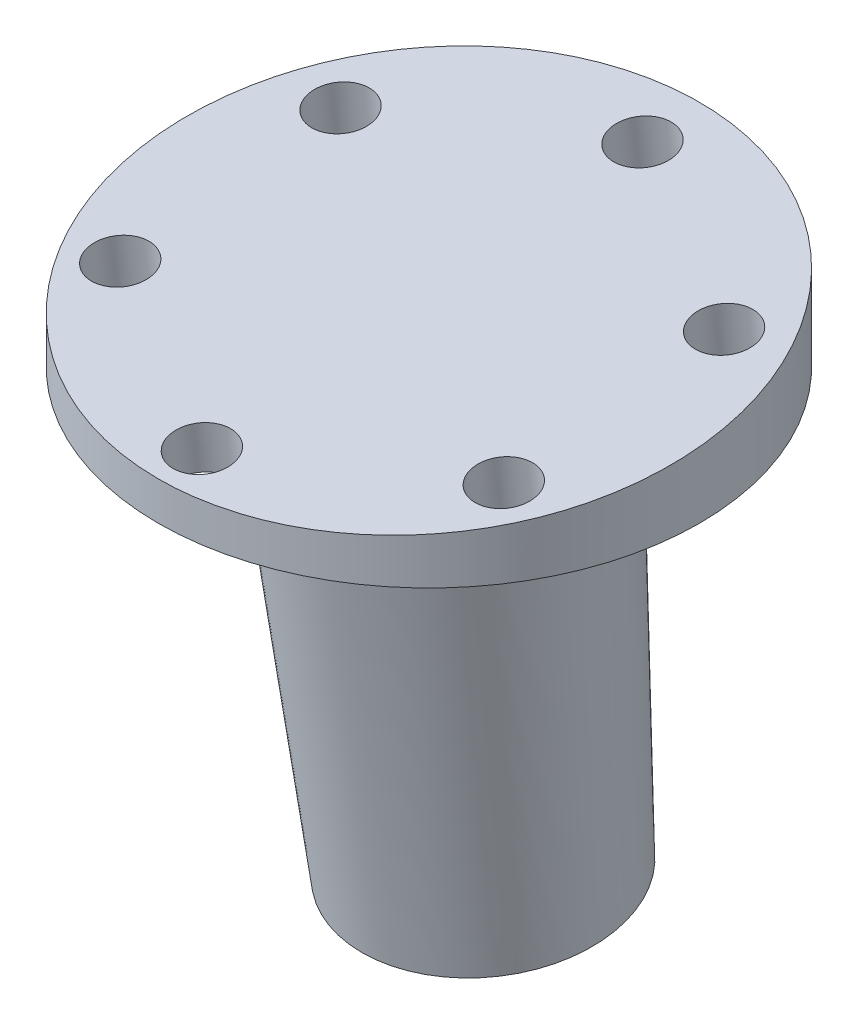
from build123d import *

# Parameters (mm, degrees)
SKETCH1_R           = 31.65
BOSS_EXTRUDE1_DEPTH = 11
CUT_EXTRUDE1_DEPTH  = 35.5
SKETCH3_R           = 3.375
CUT_EXTRUDE2_DEPTH  = 21
SKETCH4_R           = 14.25
BOSS_EXTRUDE2_DEPTH = 62
SHELL1_T            = -4.2


# Read off the part's stored shape, not the designer's step: Draft1, Split1
with BuildPart() as part:
    # Sketch1 → Boss-Extrude1 (new body)
    with BuildSketch(Plane(origin=(0, 0, 0), x_dir=(1, 0, 0), z_dir=(0, 1, 0))):
        with Locations(Location((0, 0, 0), (0, 0, 270))):
            Circle(SKETCH1_R)
    extrude(amount=BOSS_EXTRUDE1_DEPTH)

    # Sketch2 → Cut-Extrude1 (cut, symmetric)
    with BuildSketch(Plane(origin=(0, 0, 0), x_dir=(0, 0, -1), z_dir=(1, 0, 0))):
        Polygon((31.65, 11), (-31.65, 4.5), (-31.65, 11), align=None)
    extrude(amount=CUT_EXTRUDE1_DEPTH, both=True, mode=Mode.SUBTRACT)

    # Sketch3 → Cut-Extrude2 (cut)
    with BuildSketch(Plane(origin=(0, 7.669134063, 0.787509817), x_dir=(1, 0, 0), z_dir=(0, 0.9947691619431022, 0.10214849214265666))):
        with Locations(Location((0, -25.899775761, 0), (0, 0, 270))):
            Circle(SKETCH3_R)
        with Locations(Location((-22.429863761, -12.94988788, 0), (0, 0, 270))):
            Circle(SKETCH3_R)
        with Locations(Location((-22.429863761, 12.94988788, 0), (0, 0, 270))):
            Circle(SKETCH3_R)
        with Locations(Location((0, 25.899775761, 0), (0, 0, 270))):
            Circle(SKETCH3_R)
        with Locations(Location((22.429863761, 12.94988788, 0), (0, 0, 270))):
            Circle(SKETCH3_R)
        with Locations(Location((22.429863761, -12.94988788, 0), (0, 0, 270))):
            Circle(SKETCH3_R)
    extrude(amount=-CUT_EXTRUDE2_DEPTH, mode=Mode.SUBTRACT)

    # Sketch4 → Boss-Extrude2 (add)
    with BuildSketch(Plane(origin=(0, 7.669134063, 0.787509817), x_dir=(1, 0, 0), z_dir=(0, 0.9947691619431022, 0.10214849214265666))):
        with Locations(Location((0, 0.791650814, 0), (0, 0, 270))):
            Circle(SKETCH4_R)
    extrude(amount=-BOSS_EXTRUDE2_DEPTH)

    # Draft1 outline → Draft1 (revolve)
    with BuildSketch(Plane(origin=(0, 0.080865937, -0.787509817), x_dir=(1, 0, 0), z_dir=(0, -0.102148492142657, 0.994769161943102))):
        Polygon((14.25, -54.290538995), (17.183507111, 1.684111168), (14.25, 1.684111168), align=None)
    revolve(axis=Axis((0, 0.080865937, -0.787509817), (0, 0.994769161943102, 0.102148492142657)))


with BuildPart() as body_2:
    # Split1: the piece on the far side of the plane
    add(part.part)
    split(bisect_by=Plane(origin=(0, 0, 0), x_dir=(1, 0, 0), z_dir=(0, 1, 0)), keep=Keep.BOTTOM)

    # Shell1
    shell1_openings = [body_2.faces().sort_by_distance(p)[0] for p in [
        (0, -53.92568804, -6.333206513),
    ]]
    offset(amount=SHELL1_T, openings=shell1_openings, kind=Kind.INTERSECTION)


with BuildPart() as part_1:
    add(part.part)

    # Split1
    split(bisect_by=Plane(origin=(0, 0, 0), x_dir=(1, 0, 0), z_dir=(0, 1, 0)), keep=Keep.TOP)


with BuildPart() as body_2_1:
    add(body_2.part)

    # Combine1: union part
    add(part_1.part)


solid = body_2_1.part
